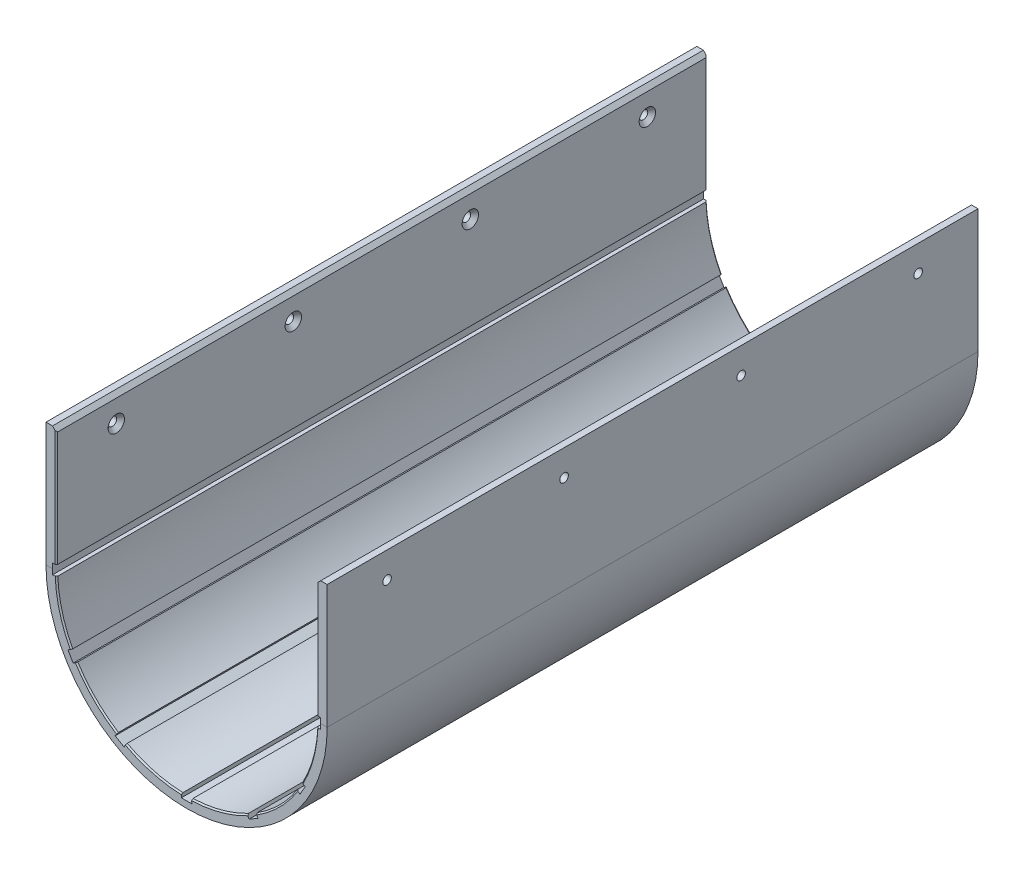
from build123d import *

# Parameters (mm, degrees)
SM_BASE_FLANGE_1_DEPTH     = 250
CHAMFER_2_SIZE             = 1
CUT_EXTRUDE_1_DEPTH        = 523.807804073
PATTERN_CIRCULAR_1_COUNT   = 4
PATTERN_CIRCULAR_1_ANGLE   = 90
F_1_THE_OTHER_WAY_COUNT    = 4
F_1_THE_OTHER_WAY_ANGLE    = 90
CHAMFER_1_SIZE             = 3
HOLE_WIZARD_M61_AT_2_COUNT = 2
HOLE_WIZARD_M61_AT_2_PITCH = 136
HOLE_WIZARD_M61_AT_3_COUNT = 2
HOLE_WIZARD_M61_AT_3_PITCH = 272
HOLE_WIZARD_M61_AT_4_COUNT = 2
HOLE_WIZARD_M61_AT_4_PITCH = 408


# Sheet-metal steps are written as plain solids
with BuildPart() as part:
    # Sketch 2 → Базовая кромка1 (new, symmetric)
    with BuildSketch(Plane.XY):
        with BuildLine():
            Line((100, 95), (100, 0))
            ThreePointArc((100, 0), (0, -100), (-100, 0))
            Line((-100, 0), (-100, 95))
            Line((-100, 95), (-108, 95))
            Line((-108, 95), (-108, 0))
            ThreePointArc((-108, 0), (0, -108), (108, 0))
            Line((108, 0), (108, 95))
            Line((108, 95), (100, 95))
        make_face()
    extrude(amount=SM_BASE_FLANGE_1_DEPTH, both=True)

    # Фаска2
    chamfer_2_edges = [part.edges().sort_by_distance(p)[0] for p in [
        (100, 47.5, 250),
        (0, -100, 250),
        (-100, 47.5, 250),
        (0, -100, -250),
        (100, 47.5, -250),
        (-100, 47.5, -250),
    ]]
    chamfer(chamfer_2_edges, length=CHAMFER_2_SIZE)

    # Эскиз7 → Вырез-Вытянуть1 (cut, symmetric)
    with BuildSketch(Plane.XY.offset(250)):
        Polygon((0, 0), (-4, -102.92230079), (4, -102.92230079), align=None)
    cut_extrude_1 = extrude(amount=CUT_EXTRUDE_1_DEPTH, both=True, mode=Mode.SUBTRACT)

    # Круговой массив1: Вырез-Вытянуть1 ×4 about axis
    pattern_circular_1_axis = Axis((0, 0, 0), (0, 0, -1))
    for i in range(1, PATTERN_CIRCULAR_1_COUNT):
        add(cut_extrude_1.rotate(pattern_circular_1_axis, i * PATTERN_CIRCULAR_1_ANGLE / (PATTERN_CIRCULAR_1_COUNT - 1)), mode=Mode.SUBTRACT)

    # 1 the other way: Вырез-Вытянуть1 ×4 about axis
    f_1_the_other_way_axis = Axis((0, 0, 0), (0, 0, 1))
    for i in range(1, F_1_THE_OTHER_WAY_COUNT):
        add(cut_extrude_1.rotate(f_1_the_other_way_axis, i * F_1_THE_OTHER_WAY_ANGLE / (F_1_THE_OTHER_WAY_COUNT - 1)), mode=Mode.SUBTRACT)

    # Фаска1
    chamfer_1_edges = [part.edges().sort_by_distance(p)[0] for p in [
        (100, 95, 0),
        (-100, 95, 0),
    ]]
    chamfer(chamfer_1_edges, length=CHAMFER_1_SIZE)

    # Эскиз9 → Зенковка для винта с полупотайной головкой M61 (revolve, cut)
    with BuildSketch(Plane(origin=(-100, 75, 204), x_dir=(0, 0, -1), z_dir=(0, 1, 0))):
        Polygon((0, 0), (0, 18.982840043), (3.3, 17), (3.3, 3), (6.3, 0), align=None)
    hole_wizard_m61 = revolve(axis=Axis((-93.65, 75, 204), (-1, 0, 0)), mode=Mode.SUBTRACT)

    # Зенковка для винта с полупотайной головкой M61 at 2: Зенковка для винта с полупотайной головкой M61 ×2
    with Locations(*[(0, 0, -i * HOLE_WIZARD_M61_AT_2_PITCH) for i in range(1, HOLE_WIZARD_M61_AT_2_COUNT)]):
        add(hole_wizard_m61, mode=Mode.SUBTRACT)

    # Зенковка для винта с полупотайной головкой M61 at 3: Зенковка для винта с полупотайной головкой M61 ×2
    with Locations(*[(0, 0, -i * HOLE_WIZARD_M61_AT_3_PITCH) for i in range(1, HOLE_WIZARD_M61_AT_3_COUNT)]):
        add(hole_wizard_m61, mode=Mode.SUBTRACT)

    # Зенковка для винта с полупотайной головкой M61 at 4: Зенковка для винта с полупотайной головкой M61 ×2
    with Locations(*[(0, 0, -i * HOLE_WIZARD_M61_AT_4_PITCH) for i in range(1, HOLE_WIZARD_M61_AT_4_COUNT)]):
        add(hole_wizard_m61, mode=Mode.SUBTRACT)

    # Зеркальное отражение1: Зенковка для винта с полупотайной головкой M61 across plane
    add(hole_wizard_m61.mirror(Plane(origin=(0, 0, 0), x_dir=(0, 0, 1), z_dir=(1, 0, 0))), mode=Mode.SUBTRACT)

    # Зеркальное отражение1 copy 1 sketch → Зеркальное отражение1 copy 1 (revolve, cut)
    with BuildSketch(Plane(origin=(100, 75, 68), x_dir=(0, 0, -1), z_dir=(0, 1, 0))):
        Polygon((0, 0), (0, -18.982840043), (3.3, -17), (3.3, -3), (6.3, 0), align=None)
    revolve(axis=Axis((93.65, 75, 68), (-1, 0, 0)), mode=Mode.SUBTRACT)

    # Зеркальное отражение1 copy 2 sketch → Зеркальное отражение1 copy 2 (revolve, cut)
    with BuildSketch(Plane(origin=(100, 75, -68), x_dir=(0, 0, -1), z_dir=(0, 1, 0))):
        Polygon((0, 0), (0, -18.982840043), (3.3, -17), (3.3, -3), (6.3, 0), align=None)
    revolve(axis=Axis((93.65, 75, -68), (-1, 0, 0)), mode=Mode.SUBTRACT)

    # Зеркальное отражение1 copy 3 sketch → Зеркальное отражение1 copy 3 (revolve, cut)
    with BuildSketch(Plane(origin=(100, 75, -204), x_dir=(0, 0, -1), z_dir=(0, 1, 0))):
        Polygon((0, 0), (0, -18.982840043), (3.3, -17), (3.3, -3), (6.3, 0), align=None)
    revolve(axis=Axis((93.65, 75, -204), (-1, 0, 0)), mode=Mode.SUBTRACT)


solid = part.part
